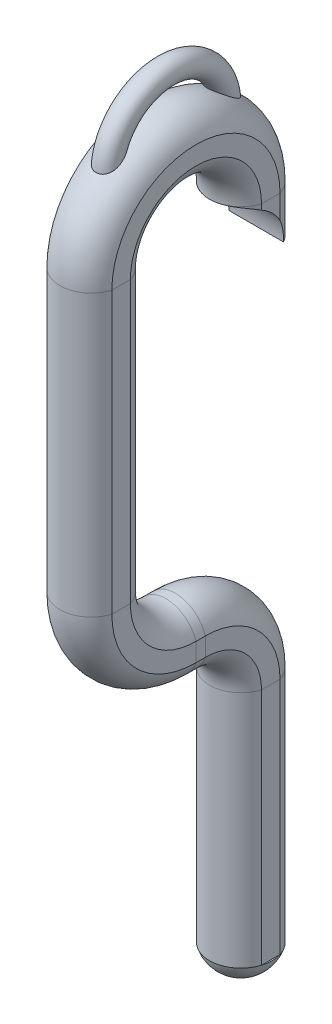
from build123d import *

# Parameters (mm, degrees)
SWEEP2_PROFILE_R        = 3.175
CUT_EXTRUDE1_DEPTH      = 225.061835523
CUT_EXTRUDE1_DEPTH_BACK = 225.061835523


with BuildPart() as part:
    # Sweep1: sweep along a path in Sketch1
    with BuildLine(Plane.YZ) as sweep1_path:
        Line((0, 0), (64.77, 0))
        ThreePointArc((64.77, 0), (77.342358569, 5.207641431), (82.55, 17.78))
        Line((82.55, 17.78), (82.55, 20.32))
        ThreePointArc((82.55, 20.32), (88.501590206, 34.688409794), (102.87, 40.64))
        Line((102.87, 40.64), (179.07, 40.64))
        ThreePointArc((179.07, 40.64), (199.39, 20.32), (179.07, 0))
        Line((179.07, 0), (166.37, 0))
    # Sketch2 → Sweep1 (sweep)
    with BuildSketch(Plane(origin=(0, 0, 0), x_dir=(-1, 0, 0), z_dir=(0, 1, 0))):
        with BuildLine():
            Line((-8.128, 2.5146), (-8.128, -2.5146))
            ThreePointArc((-8.128, -2.5146), (0, -8.505923095), (8.128, -2.5146))
            Line((8.128, -2.5146), (8.128, 2.5146))
            ThreePointArc((8.128, 2.5146), (0, 8.505923095), (-8.128, 2.5146))
        make_face()
    sweep(path=sweep1_path.line)

    # Sweep2: sweep along a path in Sketch3
    with BuildLine(Plane.YZ) as sweep2_path:
        ThreePointArc((199.39, 36.195), (215.265, 20.32), (199.39, 4.445))
    # Sweep2 profile (on start of the path) → Sweep2 (sweep)
    with BuildSketch(Plane(origin=(0, 199.39, 36.195), x_dir=(0, 0, 1), z_dir=(0, 1, 0))):
        Circle(SWEEP2_PROFILE_R)
    sweep(path=sweep2_path.line)

    # Sketch3<3> → Revolve1 (revolve)
    with BuildSketch(Plane.YZ):
        with BuildLine():
            Line((0, 0), (0, 8.505923095))
            ThreePointArc((0, 8.505923095), (-4.587412893, 5.307382304), (-6.35, 0))
            Line((-6.35, 0), (0, 0))
        make_face()
    revolve(axis=Axis((0, 0, 0), (0, -1, 0)))

    # Sketch3<4> → Cut-Extrude1 (cut, two sides: drawn at the far end of the back side and taken through both)
    with BuildSketch(Plane.YZ.offset(-CUT_EXTRUDE1_DEPTH_BACK)):
        with BuildLine():
            Line((166.37, -4.194076905), (166.37, 8.505923095))
            Line((166.37, 8.505923095), (179.07, 8.505923095))
            ThreePointArc((179.07, 8.505923095), (175.350256121, -0.474333026), (166.37, -4.194076905))
        make_face()
    extrude(amount=CUT_EXTRUDE1_DEPTH + CUT_EXTRUDE1_DEPTH_BACK, mode=Mode.SUBTRACT)


solid = part.part
